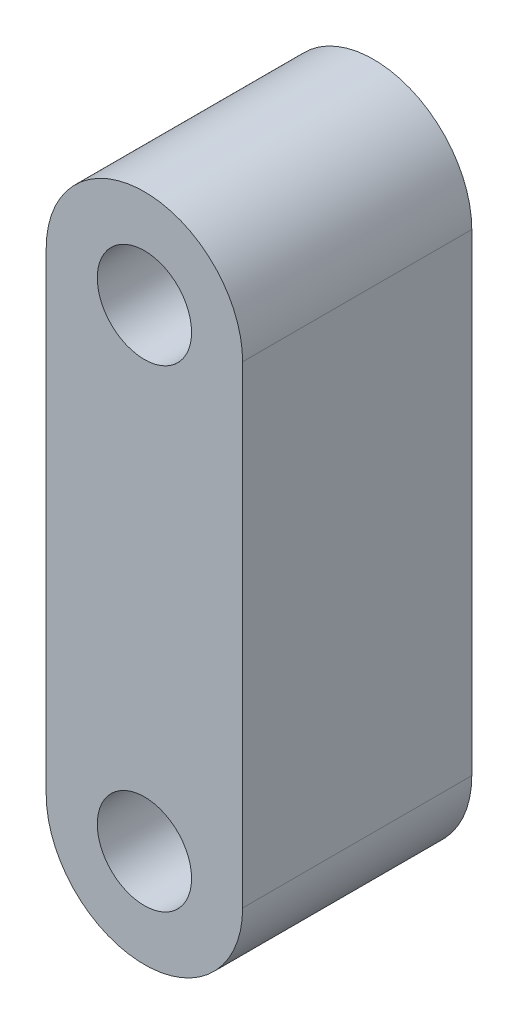
from build123d import *

# Parameters (mm, degrees)
SKETCH1_R           = 2.286
BOSS_EXTRUDE1_DEPTH = 11.1125


with BuildPart() as part:
    # Sketch1 → Boss-Extrude1 (new body)
    with BuildSketch(Plane.XY):
        with BuildLine():
            Line((4.7625, 22.9362), (4.7625, 0))
            ThreePointArc((4.7625, 0), (0, -4.7625), (-4.7625, 0))
            Line((-4.7625, 0), (-4.7625, 22.9362))
            ThreePointArc((-4.7625, 22.9362), (0, 27.6987), (4.7625, 22.9362))
        make_face()
        Circle(SKETCH1_R, mode=Mode.SUBTRACT)
        with Locations((0, 22.9362)):
            Circle(SKETCH1_R, mode=Mode.SUBTRACT)
    extrude(amount=BOSS_EXTRUDE1_DEPTH)


solid = part.part
